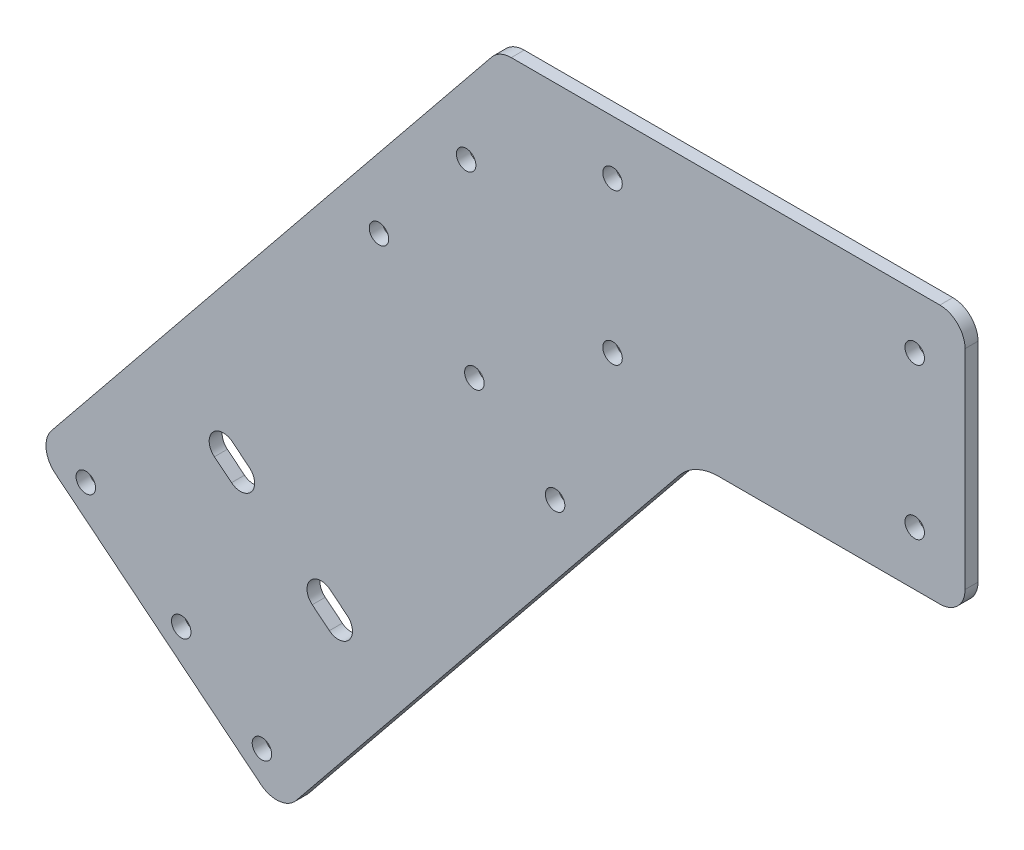
from build123d import *

# Parameters (mm, degrees)
SKETCH1_W                    = 117.475
SKETCH1_H                    = 65.3161
BASE_FLANGE1_DEPTH           = 3.2639
F_10_0_1935_DIAMETER_HOLE1_D = 4.9149
BOSS_EXTRUDE1_DEPTH          = 3.2639
F_1_4_START                  = -3.2639
F_1_4_CLEARANCE_SLOT1_DEPTH  = 3.2639
F_10_0_1935_DIAMETER_HOLE2_D = 4.9149
FILLET1_R                    = 6.35
FILLET2_R                    = 12.7


# Read off the part's stored shape, not the designer's step: 1/4 Clearance Slot1
# Sheet-metal steps are written as plain solids
with BuildPart() as part:
    # Sketch1 → Base-Flange1 (new body)
    with BuildSketch(Plane.XY):
        with Locations((58.7375, 0)):
            Rectangle(SKETCH1_W, SKETCH1_H)
    extrude(amount=-BASE_FLANGE1_DEPTH)

    # #10 (0.1935) Diameter Hole1 (through all)
    with Locations(Plane.XY):
        with Locations((28.575, 19.05), (28.575, -19.05), (104.775, 19.05), (104.775, -19.05)):
            Hole(F_10_0_1935_DIAMETER_HOLE1_D / 2)

    # Sketch8 → Boss-Extrude1 (add)
    with BuildSketch(Plane.XY):
        Polygon((0, 32.65805), (-116.888396133, -111.687098016), (-55.202435442, -161.639404056), (49.244605652, -32.65805), (0, -32.65805), align=None)
    extrude(amount=-BOSS_EXTRUDE1_DEPTH)

    # 1/4 Clearance Slot1 outline → 1/4 Clearance Slot1 (cut)
    with BuildSketch(Plane.XY.offset(F_1_4_START)):
        with BuildLine():
            Line((-71.825899608, -91.951886399), (-67.506895384, -95.449347058))
            ThreePointArc((-67.506895384, -95.449347058), (-62.484066487, -94.921426468), (-63.011987077, -89.898597571))
            Line((-63.011987077, -89.898597571), (-67.330991301, -86.401136912))
            ThreePointArc((-67.330991301, -86.401136912), (-72.353820198, -86.929057502), (-71.825899608, -91.951886399))
        make_face()
        with BuildLine():
            ThreePointArc((-42.832511108, -115.430269474), (-37.809682211, -114.902348884), (-38.337602801, -109.879519987))
            Line((-38.337602801, -109.879519987), (-42.656607025, -106.382059328))
            ThreePointArc((-42.656607025, -106.382059328), (-47.679435921, -106.909979918), (-47.151515331, -111.932808814))
            Line((-47.151515331, -111.932808814), (-42.832511108, -115.430269474))
        make_face()
    extrude(amount=F_1_4_CLEARANCE_SLOT1_DEPTH, mode=Mode.SUBTRACT)

    # #10 (0.1935) Diameter Hole2 (through all)
    with Locations(Plane.XY):
        with Locations((-30.326764214, -22.450322184), (-104.256177153, -113.745544006), (14.087127483, -58.415982533), (-59.842285455, -149.711204355), (-6.269239545, -41.93172154), (-80.198652483, -133.226943362), (-8.347749557, 4.69150052)):
            Hole(F_10_0_1935_DIAMETER_HOLE2_D / 2)

    # Fillet1
    fillet1_edges = [part.edges().sort_by_distance(p)[0] for p in [
        (-116.888396133, -111.687098016, -1.63195),
        (-55.202435442, -161.639404056, -1.63195),
        (0, 32.65805, -1.63195),
        (117.475, 32.65805, -1.63195),
        (117.475, -32.65805, -1.63195),
    ]]
    fillet(fillet1_edges, radius=FILLET1_R)

    # Fillet2
    fillet2_edges = [part.edges().sort_by_distance(p)[0] for p in [
        (49.244605652, -32.65805, -1.63195),
    ]]
    fillet(fillet2_edges, radius=FILLET2_R)


solid = part.part
